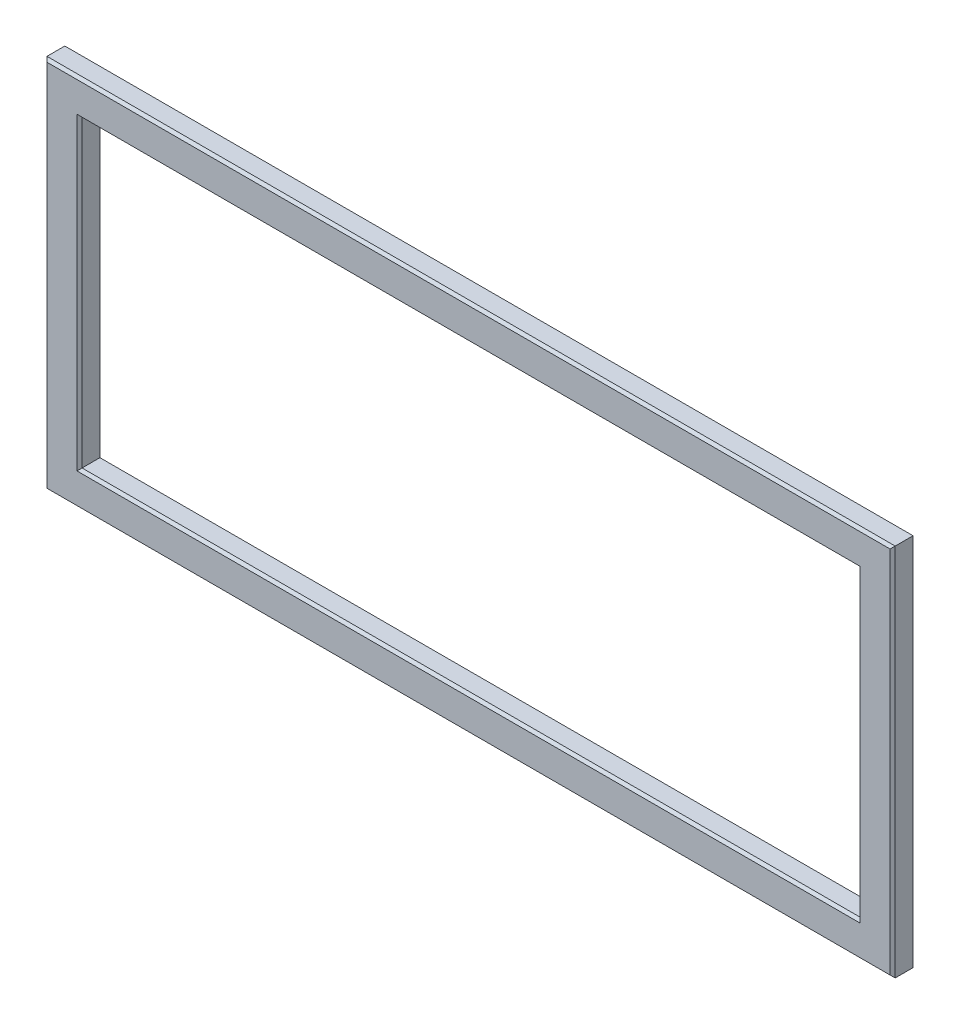
from build123d import *

# Parameters (mm, degrees)
SKETCH2_W               = 332.275
SKETCH2_H               = 146.5375
SKETCH2_W_2             = 304.75
SKETCH2_H_2             = 119.0125
BOSS_EXTRUDE2_DEPTH     = 8
CHAMFER1_SIZE           = 1
M2_5_TAPPED_HOLE1_D     = 2.05
M2_5_TAPPED_HOLE1_DEPTH = 6.35
M2_5_TAPPED_HOLE1_TIP   = 0.615882135


with BuildPart() as part:
    # Sketch2 → Boss-Extrude2 (new body)
    with BuildSketch(Plane.XY.offset(1)):
        with Locations((161.924998435, 69.056249667)):
            Rectangle(SKETCH2_W, SKETCH2_H)
        with Locations((161.924998435, 69.056249667)):
            Rectangle(SKETCH2_W_2, SKETCH2_H_2, mode=Mode.SUBTRACT)
    extrude(amount=BOSS_EXTRUDE2_DEPTH)

    # Chamfer1
    chamfer1_edges = [part.edges().sort_by_distance(p)[0] for p in [
        (328.062498435, 69.056249667, 9),
        (161.924998435, -4.212500333, 9),
        (-4.212501565, 69.056249667, 9),
        (161.924998435, 142.324999667, 9),
        (9.549998435, 69.056249667, 9),
        (161.924998435, 9.549999667, 9),
        (314.299998435, 69.056249667, 9),
        (161.924998435, 128.562499667, 9),
    ]]
    chamfer(chamfer1_edges, length=CHAMFER1_SIZE)

    # M2.5 Tapped Hole1
    with Locations(Plane(origin=(0, 0, 1), x_dir=(-1, 0, 0), z_dir=(0, 0, -1))):
        with Locations((-285.799998435, 132.562499667), (-318.299998435, 110.062499667), (-318.299998435, 28.049999667), (-285.799998435, 5.549999667), (-161.924998435, 5.549999667), (-38.049998435, 5.549999667), (-5.549998435, 28.049999667), (-38.049998435, 132.562499667), (-5.549998435, 110.062499667), (-161.924998435, 132.562499667)):
            Hole(M2_5_TAPPED_HOLE1_D / 2, depth=M2_5_TAPPED_HOLE1_DEPTH)
            with Locations((0, 0, -(M2_5_TAPPED_HOLE1_DEPTH + M2_5_TAPPED_HOLE1_TIP / 2))):  # 118° drill point
                Cone(0, M2_5_TAPPED_HOLE1_D / 2, M2_5_TAPPED_HOLE1_TIP, mode=Mode.SUBTRACT)


solid = part.part
